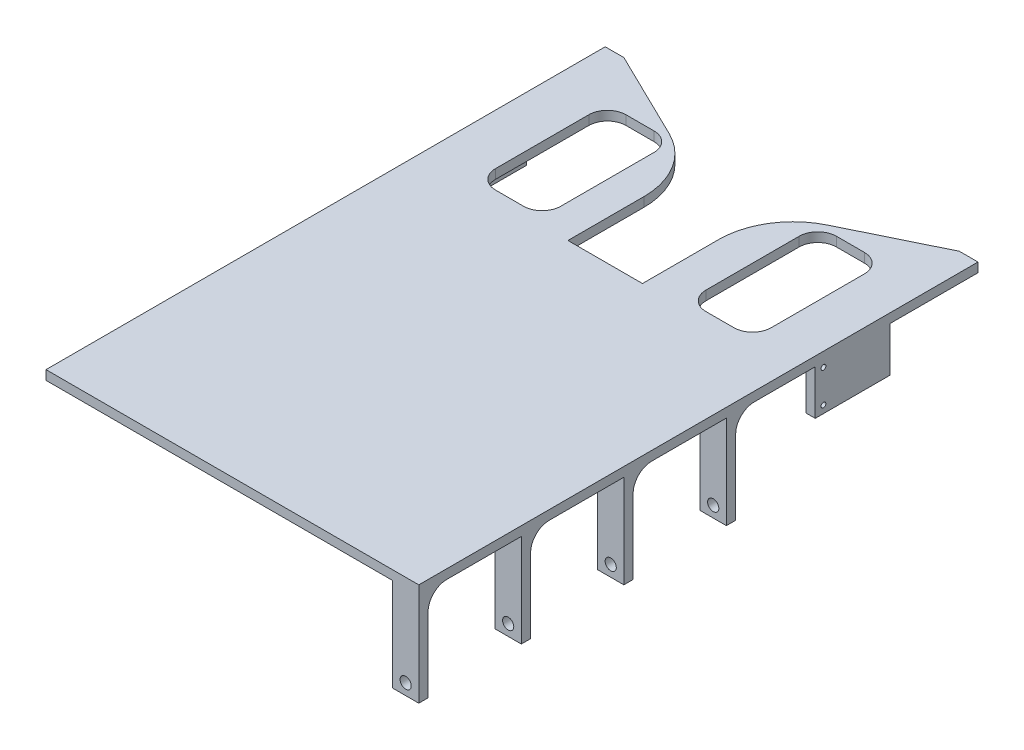
from build123d import *

# Parameters (mm, degrees)
BOSS_EXTRUDE1_DEPTH = 5
SKETCH2_W           = 5
SKETCH2_H           = 40
BOSS_EXTRUDE2_DEPTH = 24
SKETCH3_R           = 1.3
CUT_EXTRUDE2_DEPTH  = 362.353012994
CUT_EXTRUDE3_REACH  = 363.72
SKETCH4_W           = 35
SKETCH4_H           = 70
FILLET1_R           = 10
FILLET2_R           = 40
SKETCH5_W           = 14.100331178
SKETCH5_H           = 5
BOSS_EXTRUDE3_DEPTH = 50
FILLET3_R           = 10
SKETCH6_R           = 3
CUT_EXTRUDE4_DEPTH  = 365.005494464


with BuildPart() as part:
    # Sketch1 → Boss-Extrude1 (new body)
    with BuildSketch(Plane(origin=(0, 0, 0), x_dir=(1, 0, 0), z_dir=(0, 1, 0))):
        Polygon((0, 0), (0, -300), (200, -300), (200, 0), (190, 0), (120, -34.158147671), (120, -100), (80, -100), (80, -34.158147671), (10, 0), align=None)
    extrude(amount=BOSS_EXTRUDE1_DEPTH)

    # Sketch2 → Boss-Extrude2 (add)
    with BuildSketch(Plane.XZ):
        with Locations((2.5, 67.320933646)):
            Rectangle(SKETCH2_W, SKETCH2_H)
        with Locations((197.5, 67.320933646)):
            Rectangle(SKETCH2_W, SKETCH2_H)
    extrude(amount=BOSS_EXTRUDE2_DEPTH)

    # Sketch3 → Cut-Extrude2 (cut, through all)
    with BuildSketch(Plane(origin=(200, 0, 0), x_dir=(0, 0, -1), z_dir=(1, 0, 0))):
        with Locations((-82.9, -2.5)):
            Circle(SKETCH3_R)
        with Locations((-82.9, -20)):
            Circle(SKETCH3_R)
    extrude(amount=-CUT_EXTRUDE2_DEPTH, mode=Mode.SUBTRACT)

    # Sketch4 → Cut-Extrude3 (cut, up to next)
    with BuildSketch(Plane(origin=(0, 5, 0), x_dir=(1, 0, 0), z_dir=(0, 1, 0)), mode=Mode.PRIVATE) as cut_extrude3_sk1:
        with Locations((157.554129327, -61)):
            Rectangle(SKETCH4_W, SKETCH4_H)
    cut_extrude3_tool1 = extrude(cut_extrude3_sk1.sketch, amount=-CUT_EXTRUDE3_REACH, mode=Mode.PRIVATE) & part.part
    # Sketch4 → Cut-Extrude3 (cut, up to next)
    with BuildSketch(Plane(origin=(0, 5, 0), x_dir=(1, 0, 0), z_dir=(0, 1, 0)), mode=Mode.PRIVATE) as cut_extrude3_sk2:
        with Locations((44.67599733, -61)):
            Rectangle(SKETCH4_W, SKETCH4_H)
    cut_extrude3_tool2 = extrude(cut_extrude3_sk2.sketch, amount=-CUT_EXTRUDE3_REACH, mode=Mode.PRIVATE) & part.part
    add(cut_extrude3_tool1.solids().sort_by_distance((157.554129, 5, 61))[0], mode=Mode.SUBTRACT)
    add(cut_extrude3_tool2.solids().sort_by_distance((44.675997, 5, 61))[0], mode=Mode.SUBTRACT)

    # Fillet1
    fillet1_edges = [part.edges().sort_by_distance(p)[0] for p in [
        (27.17599733, 2.5, 26),
        (27.17599733, 2.5, 96),
        (62.17599733, 2.5, 96),
        (62.17599733, 2.5, 26),
        (140.054129327, 2.5, 96),
        (175.054129327, 2.5, 96),
        (175.054129327, 2.5, 26),
        (140.054129327, 2.5, 26),
    ]]
    fillet(fillet1_edges, radius=FILLET1_R)

    # Fillet2
    fillet2_edges = [part.edges().sort_by_distance(p)[0] for p in [
        (120, 2.5, 34.158147671),
        (80, 2.5, 34.158147671),
    ]]
    fillet(fillet2_edges, radius=FILLET2_R)

    # Sketch5 → Boss-Extrude3 (add)
    with BuildSketch(Plane.XZ):
        with Locations((192.949834411, 297.5)):
            Rectangle(SKETCH5_W, SKETCH5_H)
        with Locations((192.949834411, 242.5)):
            Rectangle(SKETCH5_W, SKETCH5_H)
        with Locations((192.949834411, 187.5)):
            Rectangle(SKETCH5_W, SKETCH5_H)
        with Locations((192.949834411, 132.5)):
            Rectangle(SKETCH5_W, SKETCH5_H)
    extrude(amount=BOSS_EXTRUDE3_DEPTH)

    # Fillet3
    fillet3_edges = [part.edges().sort_by_distance(p)[0] for p in [
        (192.949834411, 0, 130),
        (192.949834411, 0, 185),
        (192.949834411, 0, 240),
        (192.949834411, 0, 295),
    ]]
    fillet(fillet3_edges, radius=FILLET3_R)

    # Sketch6 → Cut-Extrude4 (cut, through all)
    with BuildSketch(Plane.XY.offset(300)):
        with Locations((192.949834411, -44)):
            Circle(SKETCH6_R)
    extrude(amount=-CUT_EXTRUDE4_DEPTH, mode=Mode.SUBTRACT)


solid = part.part
